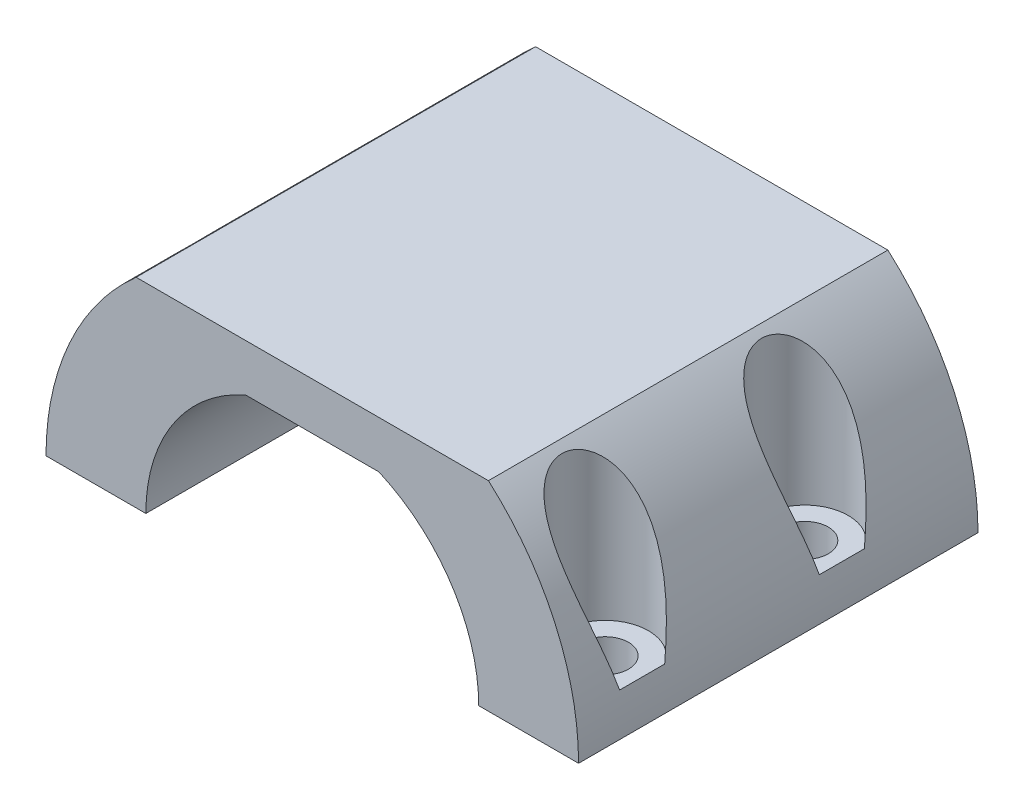
from build123d import *

# Parameters (mm, degrees)
BOSS_EXTRUDE1_DEPTH = 30
SKETCH2_R           = 1.75
CUT_EXTRUDE2_DEPTH  = 42.231056256
SKETCH4_R           = 3.25
SKETCH4_R_2         = 1.75
CUT_EXTRUDE3_DEPTH  = 40.862263024
SKETCH5_W           = 33.611871568
SKETCH5_H           = 10
CUT_EXTRUDE4_DEPTH  = 42.231056426


with BuildPart() as part:
    # Sketch1 → Boss-Extrude1 (new body)
    with BuildSketch(Plane.XY):
        with BuildLine():
            Line((-20, 0), (-12.5, 0))
            ThreePointArc((-12.5, 0), (-10.458250332, 6.846531969), (-5, 11.456439237))
            Line((-5, 11.456439237), (5, 11.456439237))
            ThreePointArc((5, 11.456439237), (10.458250332, 6.846531969), (12.5, 0))
            Line((12.5, 0), (20, 0))
            ThreePointArc((20, 0), (0, 20), (-20, 0))
        make_face()
    extrude(amount=BOSS_EXTRUDE1_DEPTH)

    # Sketch2 → Cut-Extrude2 (cut, through all)
    with BuildSketch(Plane(origin=(0, 0, 0), x_dir=(1, 0, 0), z_dir=(0, 1, 0))):
        with Locations((-17, -10)):
            Circle(SKETCH2_R)
        with Locations((17, -10)):
            Circle(SKETCH2_R)
        with Locations((17, -25)):
            Circle(SKETCH2_R)
        with Locations((-17, -25)):
            Circle(SKETCH2_R)
    extrude(amount=CUT_EXTRUDE2_DEPTH, mode=Mode.SUBTRACT)

    # Sketch4 → Cut-Extrude3 (cut, through all)
    # profile 1 of 4: a face of its own
    with BuildSketch(Plane(origin=(0, 3, 0), x_dir=(1, 0, 0), z_dir=(0, 1, 0))):
        with Locations((17, -10)):
            Circle(SKETCH4_R)
        with Locations((17, -10)):
            Circle(SKETCH4_R_2, mode=Mode.SUBTRACT)
    # profile 2 of 4: a face of its own
    with BuildSketch(Plane(origin=(0, 3, 0), x_dir=(1, 0, 0), z_dir=(0, 1, 0))):
        with Locations((17, -25)):
            Circle(SKETCH4_R)
        with Locations((17, -25)):
            Circle(SKETCH4_R_2, mode=Mode.SUBTRACT)
    # profile 3 of 4: a face of its own
    with BuildSketch(Plane(origin=(0, 3, 0), x_dir=(1, 0, 0), z_dir=(0, 1, 0))):
        with Locations((-17, -25)):
            Circle(SKETCH4_R)
        with Locations((-17, -25)):
            Circle(SKETCH4_R_2, mode=Mode.SUBTRACT)
    # profile 4 of 4: a face of its own
    with BuildSketch(Plane(origin=(0, 3, 0), x_dir=(1, 0, 0), z_dir=(0, 1, 0))):
        with Locations((-17, -10)):
            Circle(SKETCH4_R)
        with Locations((-17, -10)):
            Circle(SKETCH4_R_2, mode=Mode.SUBTRACT)
    extrude(amount=CUT_EXTRUDE3_DEPTH, mode=Mode.SUBTRACT)

    # Sketch5 → Cut-Extrude4 (cut, through all)
    with BuildSketch(Plane.XY.offset(30)):
        with Locations((0, 20)):
            Rectangle(SKETCH5_W, SKETCH5_H)
    extrude(amount=-CUT_EXTRUDE4_DEPTH, mode=Mode.SUBTRACT)


solid = part.part
